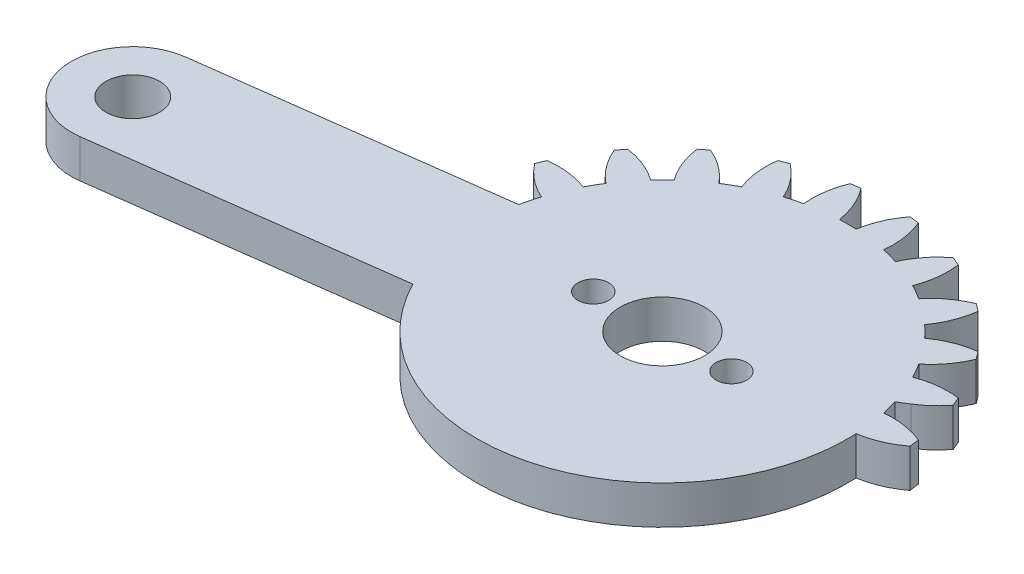
from build123d import *
from build123d.topology import SkipClean

# Parameters (mm, degrees)
SKETCH1_R           = 1.5
BOSS_EXTRUDE1_DEPTH = 2.5
BOSS_EXTRUDE2_START = -2.5
SKETCH3_R           = 1.5
SKETCH3_R_2         = 1.75
BOSS_EXTRUDE2_DEPTH = 2.5
CUT_EXTRUDE1_START  = -4
CUT_EXTRUDE1_DEPTH  = 4
CUT_EXTRUDE2_REACH  = 48.97
SKETCH5_R           = 2.75
SKETCH5_R_2         = 1


with BuildPart() as part:
    # Sketch1 → Boss-Extrude1 (new body)
    with BuildSketch(Plane(origin=(0, 0, 0), x_dir=(1, 0, 0), z_dir=(0, 1, 0))):
        with BuildLine():
            Line((20.643657446, 4), (2.081641936, 4))
            ThreePointArc((2.081641936, 4), (2.861028333, 4.588201733), (3.521749436, 5.30713988))
            ThreePointArc((3.521749436, 5.30713988), (3.405395609, 5.596745198), (3.282888305, 5.883801663))
            ThreePointArc((3.282888305, 5.883801663), (1.93527598, 5.894040025), (0.627094961, 5.57027124))
            ThreePointArc((0.627094961, 5.57027124), (0.366286148, 6.046375), (0.084372603, 6.510293938))
            ThreePointArc((0.084372603, 6.510293938), (1.018855105, 7.48132754), (1.683794586, 8.65351323))
            ThreePointArc((1.683794586, 8.65351323), (1.496450048, 8.903135899), (1.303821399, 9.148703928))
            ThreePointArc((1.303821399, 9.148703928), (-0.000522033, 8.809805691), (-1.180330337, 8.158486898))
            ThreePointArc((-1.180330337, 8.158486898), (-1.555477026, 8.550865528), (-1.947855656, 8.926012217))
            ThreePointArc((-1.947855656, 8.926012217), (-1.296536862, 10.105820521), (-0.957638625, 11.410163953))
            ThreePointArc((-0.957638625, 11.410163953), (-1.203206655, 11.602792602), (-1.452829324, 11.79013714))
            ThreePointArc((-1.452829324, 11.79013714), (-2.625015014, 11.125197659), (-3.596048616, 10.190715157))
            ThreePointArc((-3.596048616, 10.190715157), (-4.059967554, 10.472628702), (-4.536071314, 10.733437515))
            ThreePointArc((-4.536071314, 10.733437515), (-4.212302529, 12.041618533), (-4.222540891, 13.389230859))
            ThreePointArc((-4.222540891, 13.389230859), (-4.509597355, 13.511738163), (-4.799202674, 13.62809199))
            ThreePointArc((-4.799202674, 13.62809199), (-5.759348103, 12.682425791), (-6.455432668, 11.528463019))
            ThreePointArc((-6.455432668, 11.528463019), (-6.976508546, 11.680699536), (-7.503891752, 11.809396783))
            ThreePointArc((-7.503891752, 11.809396783), (-7.529737283, 13.156800143), (-7.888414517, 14.455843809))
            ThreePointArc((-7.888414517, 14.455843809), (-8.197396993, 14.499881098), (-8.507248835, 14.537314892))
            ThreePointArc((-8.507248835, 14.537314892), (-9.18992168, 13.375367565), (-9.563620196, 12.080565177))
            ThreePointArc((-9.563620196, 12.080565177), (-10.106342554, 12.09275), (-10.649064912, 12.080565177))
            ThreePointArc((-10.649064912, 12.080565177), (-11.022763428, 13.375367565), (-11.705436272, 14.537314892))
            ThreePointArc((-11.705436272, 14.537314892), (-12.015288115, 14.499881098), (-12.324270591, 14.455843809))
            ThreePointArc((-12.324270591, 14.455843809), (-12.682947825, 13.156800143), (-12.708793355, 11.809396783))
            ThreePointArc((-12.708793355, 11.809396783), (-13.236176561, 11.680699536), (-13.757252439, 11.528463019))
            ThreePointArc((-13.757252439, 11.528463019), (-14.453337005, 12.682425791), (-15.413482434, 13.62809199))
            ThreePointArc((-15.413482434, 13.62809199), (-15.703087752, 13.511738163), (-15.990144217, 13.389230859))
            ThreePointArc((-15.990144217, 13.389230859), (-16.000382579, 12.041618533), (-15.676613793, 10.733437515))
            ThreePointArc((-15.676613793, 10.733437515), (-16.152717554, 10.472628702), (-16.616636492, 10.190715157))
            ThreePointArc((-16.616636492, 10.190715157), (-17.587670094, 11.125197659), (-18.759855783, 11.79013714))
            ThreePointArc((-18.759855783, 11.79013714), (-19.009478453, 11.602792602), (-19.255046482, 11.410163953))
            ThreePointArc((-19.255046482, 11.410163953), (-18.916148245, 10.105820521), (-18.264829452, 8.926012217))
            ThreePointArc((-18.264829452, 8.926012217), (-18.657208082, 8.550865528), (-19.032354771, 8.158486898))
            ThreePointArc((-19.032354771, 8.158486898), (-20.212163074, 8.809805691), (-21.516506507, 9.148703928))
            ThreePointArc((-21.516506507, 9.148703928), (-21.709135156, 8.903135899), (-21.896479694, 8.65351323))
            ThreePointArc((-21.896479694, 8.65351323), (-21.231540213, 7.48132754), (-20.297057711, 6.510293938))
            ThreePointArc((-20.297057711, 6.510293938), (-20.578971255, 6.046375), (-20.839780068, 5.57027124))
            ThreePointArc((-20.839780068, 5.57027124), (-22.147961087, 5.894040025), (-23.495573413, 5.883801663))
            ThreePointArc((-23.495573413, 5.883801663), (-23.618080717, 5.596745198), (-23.734434544, 5.30713988))
            ThreePointArc((-23.734434544, 5.30713988), (-22.788768345, 4.346994451), (-21.634805572, 3.650909885))
            ThreePointArc((-21.634805572, 3.650909885), (-21.78704209, 3.129834008), (-21.915739337, 2.602450802))
            ThreePointArc((-21.915739337, 2.602450802), (-23.263142697, 2.576605271), (-24.562186363, 2.217928037))
            ThreePointArc((-24.562186363, 2.217928037), (-24.606223651, 1.908945561), (-24.643657446, 1.599093719))
            ThreePointArc((-24.643657446, 1.599093719), (-23.481710119, 0.916420874), (-22.186907731, 0.542722358))
            ThreePointArc((-22.186907731, 0.542722358), (-22.199092554, 0), (-22.186907731, -0.542722358))
            ThreePointArc((-22.186907731, -0.542722358), (-23.481710119, -0.916420874), (-24.643657446, -1.599093719))
            ThreePointArc((-24.643657446, -1.599093719), (-24.606223651, -1.908945561), (-24.562186363, -2.217928037))
            ThreePointArc((-24.562186363, -2.217928037), (-23.263142697, -2.576605271), (-21.915739337, -2.602450802))
            ThreePointArc((-21.915739337, -2.602450802), (-21.78704209, -3.129834008), (-21.634805572, -3.650909885))
            ThreePointArc((-21.634805572, -3.650909885), (-22.788768345, -4.346994451), (-23.734434544, -5.30713988))
            ThreePointArc((-23.734434544, -5.30713988), (-23.618080717, -5.596745198), (-23.495573413, -5.883801663))
            ThreePointArc((-23.495573413, -5.883801663), (-22.147961087, -5.894040025), (-20.839780068, -5.57027124))
            ThreePointArc((-20.839780068, -5.57027124), (-20.578971255, -6.046375), (-20.297057711, -6.510293938))
            ThreePointArc((-20.297057711, -6.510293938), (-21.231540213, -7.48132754), (-21.896479694, -8.65351323))
            ThreePointArc((-21.896479694, -8.65351323), (-21.709135156, -8.903135899), (-21.516506507, -9.148703928))
            ThreePointArc((-21.516506507, -9.148703928), (-20.212163074, -8.809805691), (-19.032354771, -8.158486898))
            ThreePointArc((-19.032354771, -8.158486898), (-18.657208082, -8.550865528), (-18.264829452, -8.926012217))
            ThreePointArc((-18.264829452, -8.926012217), (-18.916148245, -10.105820521), (-19.255046482, -11.410163953))
            ThreePointArc((-19.255046482, -11.410163953), (-19.009478453, -11.602792602), (-18.759855783, -11.79013714))
            ThreePointArc((-18.759855783, -11.79013714), (-17.587670094, -11.125197659), (-16.616636492, -10.190715157))
            ThreePointArc((-16.616636492, -10.190715157), (-16.152717554, -10.472628702), (-15.676613793, -10.733437515))
            ThreePointArc((-15.676613793, -10.733437515), (-16.000382579, -12.041618533), (-15.990144217, -13.389230859))
            ThreePointArc((-15.990144217, -13.389230859), (-15.703087752, -13.511738163), (-15.413482434, -13.62809199))
            ThreePointArc((-15.413482434, -13.62809199), (-14.453337005, -12.682425791), (-13.757252439, -11.528463019))
            ThreePointArc((-13.757252439, -11.528463019), (-13.236176561, -11.680699536), (-12.708793355, -11.809396783))
            ThreePointArc((-12.708793355, -11.809396783), (-12.682947825, -13.156800143), (-12.324270591, -14.455843809))
            ThreePointArc((-12.324270591, -14.455843809), (-12.015288115, -14.499881098), (-11.705436272, -14.537314892))
            ThreePointArc((-11.705436272, -14.537314892), (-11.022763428, -13.375367565), (-10.649064912, -12.080565177))
            ThreePointArc((-10.649064912, -12.080565177), (-10.106342554, -12.09275), (-9.563620196, -12.080565177))
            ThreePointArc((-9.563620196, -12.080565177), (-9.18992168, -13.375367565), (-8.507248835, -14.537314892))
            ThreePointArc((-8.507248835, -14.537314892), (-8.197396993, -14.499881098), (-7.888414517, -14.455843809))
            ThreePointArc((-7.888414517, -14.455843809), (-7.529737283, -13.156800143), (-7.503891752, -11.809396783))
            ThreePointArc((-7.503891752, -11.809396783), (-6.976508546, -11.680699536), (-6.455432668, -11.528463019))
            ThreePointArc((-6.455432668, -11.528463019), (-5.759348103, -12.682425791), (-4.799202674, -13.62809199))
            ThreePointArc((-4.799202674, -13.62809199), (-4.509597355, -13.511738163), (-4.222540891, -13.389230859))
            ThreePointArc((-4.222540891, -13.389230859), (-4.212302529, -12.041618533), (-4.536071314, -10.733437515))
            ThreePointArc((-4.536071314, -10.733437515), (-4.059967554, -10.472628702), (-3.596048616, -10.190715157))
            ThreePointArc((-3.596048616, -10.190715157), (-2.625015014, -11.125197659), (-1.452829324, -11.79013714))
            ThreePointArc((-1.452829324, -11.79013714), (-1.203206655, -11.602792602), (-0.957638625, -11.410163953))
            ThreePointArc((-0.957638625, -11.410163953), (-1.296536862, -10.105820521), (-1.947855656, -8.926012217))
            ThreePointArc((-1.947855656, -8.926012217), (-1.555477026, -8.550865528), (-1.180330337, -8.158486898))
            ThreePointArc((-1.180330337, -8.158486898), (-0.000522033, -8.809805691), (1.303821399, -9.148703928))
            ThreePointArc((1.303821399, -9.148703928), (1.496450048, -8.903135899), (1.683794586, -8.65351323))
            ThreePointArc((1.683794586, -8.65351323), (1.018855105, -7.48132754), (0.084372603, -6.510293938))
            ThreePointArc((0.084372603, -6.510293938), (0.366286148, -6.046375), (0.627094961, -5.57027124))
            ThreePointArc((0.627094961, -5.57027124), (1.93527598, -5.894040025), (3.282888305, -5.883801663))
            ThreePointArc((3.282888305, -5.883801663), (3.405395609, -5.596745198), (3.521749436, -5.30713988))
            ThreePointArc((3.521749436, -5.30713988), (2.861028333, -4.588201733), (2.081641936, -4))
            Line((2.081641936, -4), (20.643657446, -4))
            ThreePointArc((20.643657446, -4), (24.643657446, 0), (20.643657446, 4))
        make_face()
        with Locations((-10.106342554, 0)):
            Circle(SKETCH1_R, mode=Mode.SUBTRACT)
        with Locations((20.643657446, 0)):
            Circle(SKETCH1_R, mode=Mode.SUBTRACT)
    extrude(amount=BOSS_EXTRUDE1_DEPTH)

    # Sketch3 → Boss-Extrude2 (add)
    with BuildSketch(Plane(origin=(0, 2.5, 0), x_dir=(1, 0, 0), z_dir=(0, 1, 0)).offset(BOSS_EXTRUDE2_START)):
        with BuildLine():
            Line((-10.628447323, 3.965779445), (-41.11537681, -0.047900965))
            ThreePointArc((-41.11537681, -0.047900965), (-44.559051487, -4.53578518), (-40.071167272, -7.979459856))
            Line((-40.071167272, -7.979459856), (-9.584237785, -3.965779445))
            ThreePointArc((-9.584237785, -3.965779445), (-6.140563108, 0.522104769), (-10.628447323, 3.965779445))
        make_face()
        with Locations((-10.106342554, 0)):
            Circle(SKETCH3_R, mode=Mode.SUBTRACT)
        with Locations((-40.593272041, -4.013680411)):
            Circle(SKETCH3_R_2, mode=Mode.SUBTRACT)
    extrude(amount=BOSS_EXTRUDE2_DEPTH)

    # Sketch4 → Cut-Extrude1 (cut)
    with SkipClean():  # the faces are left unmerged after this step: merging them gives an invalid solid
        with BuildSketch(Plane(origin=(0, 2.5, 0), x_dir=(1, 0, 0), z_dir=(0, 1, 0)).offset(CUT_EXTRUDE1_START)):
            with BuildLine():
                ThreePointArc((20.643657446, -4), (24.643657446, 0), (20.643657446, 4))
                Line((20.643657446, 4), (2.081641936, 4))
                Line((2.081641936, 4), (1.43808022, 3.600125745))
                ThreePointArc((1.43808022, 3.600125745), (1.581217534, 3.104116905), (1.70305423, 2.602450802))
                ThreePointArc((1.70305423, 2.602450802), (3.050457589, 2.576605271), (4.349501255, 2.217928037))
                ThreePointArc((4.349501255, 2.217928037), (4.393538544, 1.908945561), (4.430972339, 1.599093719))
                ThreePointArc((4.430972339, 1.599093719), (3.269025011, 0.916420874), (1.974222624, 0.542722358))
                ThreePointArc((1.974222624, 0.542722358), (1.70305423, -2.602450802), (0.627094961, -5.57027124))
                ThreePointArc((0.627094961, -5.57027124), (1.93527598, -5.894040025), (3.282888305, -5.883801663))
                ThreePointArc((3.282888305, -5.883801663), (3.405395609, -5.596745198), (3.521749436, -5.30713988))
                ThreePointArc((3.521749436, -5.30713988), (2.861028333, -4.588201733), (2.081641936, -4))
                Line((2.081641936, -4), (20.643657446, -4))
            make_face()
            with BuildLine():
                ThreePointArc((1.683794586, -8.65351323), (1.018855105, -7.48132754), (0.084372603, -6.510293938))
                ThreePointArc((0.084372603, -6.510293938), (-0.512518948, -7.361599771), (-1.180330337, -8.158486898))
                ThreePointArc((-1.180330337, -8.158486898), (-0.000522033, -8.809805691), (1.303821399, -9.148703928))
                ThreePointArc((1.303821399, -9.148703928), (1.496450048, -8.903135899), (1.683794586, -8.65351323))
            make_face()
            with BuildLine():
                ThreePointArc((-0.957638625, -11.410163953), (-1.296536862, -10.105820521), (-1.947855656, -8.926012217))
                ThreePointArc((-1.947855656, -8.926012217), (-2.744742783, -9.593823606), (-3.596048616, -10.190715157))
                ThreePointArc((-3.596048616, -10.190715157), (-2.625015014, -11.125197659), (-1.452829324, -11.79013714))
                ThreePointArc((-1.452829324, -11.79013714), (-1.203206655, -11.602792602), (-0.957638625, -11.410163953))
            make_face()
            with BuildLine():
                ThreePointArc((-4.222540891, -13.389230859), (-4.212302529, -12.041618533), (-4.536071314, -10.733437515))
                ThreePointArc((-4.536071314, -10.733437515), (-5.478647477, -11.172244217), (-6.455432668, -11.528463019))
                ThreePointArc((-6.455432668, -11.528463019), (-5.759348103, -12.682425791), (-4.799202674, -13.62809199))
                ThreePointArc((-4.799202674, -13.62809199), (-4.509597355, -13.511738163), (-4.222540891, -13.389230859))
            make_face()
            with BuildLine():
                ThreePointArc((-7.888414517, -14.455843809), (-7.529737283, -13.156800143), (-7.503891752, -11.809396783))
                ThreePointArc((-7.503891752, -11.809396783), (-8.527921943, -11.989294847), (-9.563620196, -12.080565177))
                ThreePointArc((-9.563620196, -12.080565177), (-9.18992168, -13.375367565), (-8.507248835, -14.537314892))
                ThreePointArc((-8.507248835, -14.537314892), (-8.197396993, -14.499881098), (-7.888414517, -14.455843809))
            make_face()
            with BuildLine():
                ThreePointArc((-11.705436272, -14.537314892), (-11.022763428, -13.375367565), (-10.649064912, -12.080565177))
                ThreePointArc((-10.649064912, -12.080565177), (-11.684763165, -11.989294847), (-12.708793355, -11.809396783))
                ThreePointArc((-12.708793355, -11.809396783), (-12.682947825, -13.156800143), (-12.324270591, -14.455843809))
                ThreePointArc((-12.324270591, -14.455843809), (-12.015288115, -14.499881098), (-11.705436272, -14.537314892))
            make_face()
            with BuildLine():
                ThreePointArc((-15.413482434, -13.62809199), (-14.453337005, -12.682425791), (-13.757252439, -11.528463019))
                ThreePointArc((-13.757252439, -11.528463019), (-14.734037631, -11.172244217), (-15.676613793, -10.733437515))
                ThreePointArc((-15.676613793, -10.733437515), (-16.000382579, -12.041618533), (-15.990144217, -13.389230859))
                ThreePointArc((-15.990144217, -13.389230859), (-15.703087752, -13.511738163), (-15.413482434, -13.62809199))
            make_face()
            with BuildLine():
                ThreePointArc((-18.759855783, -11.79013714), (-17.587670094, -11.125197659), (-16.616636492, -10.190715157))
                ThreePointArc((-16.616636492, -10.190715157), (-17.467942324, -9.593823606), (-18.264829452, -8.926012217))
                ThreePointArc((-18.264829452, -8.926012217), (-18.916148245, -10.105820521), (-19.255046482, -11.410163953))
                ThreePointArc((-19.255046482, -11.410163953), (-19.009478453, -11.602792602), (-18.759855783, -11.79013714))
            make_face()
            with BuildLine():
                ThreePointArc((-21.516506507, -9.148703928), (-20.212163074, -8.809805691), (-19.032354771, -8.158486898))
                ThreePointArc((-19.032354771, -8.158486898), (-19.70016616, -7.361599771), (-20.297057711, -6.510293938))
                ThreePointArc((-20.297057711, -6.510293938), (-21.231540213, -7.48132754), (-21.896479694, -8.65351323))
                ThreePointArc((-21.896479694, -8.65351323), (-21.709135156, -8.903135899), (-21.516506507, -9.148703928))
            make_face()
            with BuildLine():
                ThreePointArc((-21.942853375, 2.47620963), (-21.92946485, 2.539366405), (-21.915739337, 2.602450802))
                ThreePointArc((-21.915739337, 2.602450802), (-23.263142697, 2.576605271), (-24.562186363, 2.217928037))
                ThreePointArc((-24.562186363, 2.217928037), (-24.56889027, 2.173784387), (-24.575459377, 2.129620475))
                Line((-24.575459377, 2.129620475), (-21.942853375, 2.47620963))
            make_face()
            with BuildLine():
                ThreePointArc((-23.495573413, -5.883801663), (-22.147961087, -5.894040025), (-20.839780068, -5.57027124))
                ThreePointArc((-20.839780068, -5.57027124), (-20.869365339, -5.512888815), (-20.898643838, -5.455349261))
                Line((-20.898643838, -5.455349261), (-23.531249839, -5.801938416))
                ThreePointArc((-23.531249839, -5.801938416), (-23.513474108, -5.842897269), (-23.495573413, -5.883801663))
            make_face()
        extrude(amount=CUT_EXTRUDE1_DEPTH, mode=Mode.SUBTRACT)

    # Sketch5 → Cut-Extrude2 (cut, up to next)
    with BuildSketch(Plane(origin=(0, 2.5, 0), x_dir=(1, 0, 0), z_dir=(0, 1, 0)), mode=Mode.PRIVATE) as cut_extrude2_sk1:
        with Locations((-10.106342554, 0)):
            Circle(SKETCH5_R)
    cut_extrude2_tool1 = extrude(cut_extrude2_sk1.sketch, amount=-CUT_EXTRUDE2_REACH, mode=Mode.PRIVATE) & part.part
    # Sketch5 → Cut-Extrude2 (cut, up to next)
    with BuildSketch(Plane(origin=(0, 2.5, 0), x_dir=(1, 0, 0), z_dir=(0, 1, 0)), mode=Mode.PRIVATE) as cut_extrude2_sk2:
        with Locations((-5.606342554, 0)):
            Circle(SKETCH5_R_2)
    cut_extrude2_tool2 = extrude(cut_extrude2_sk2.sketch, amount=-CUT_EXTRUDE2_REACH, mode=Mode.PRIVATE) & part.part
    # Sketch5 → Cut-Extrude2 (cut, up to next)
    with BuildSketch(Plane(origin=(0, 2.5, 0), x_dir=(1, 0, 0), z_dir=(0, 1, 0)), mode=Mode.PRIVATE) as cut_extrude2_sk3:
        with Locations((-14.606342554, 0)):
            Circle(SKETCH5_R_2)
    cut_extrude2_tool3 = extrude(cut_extrude2_sk3.sketch, amount=-CUT_EXTRUDE2_REACH, mode=Mode.PRIVATE) & part.part
    add(cut_extrude2_tool1.solids().sort_by_distance((-10.106343, 2.5, 0))[0], mode=Mode.SUBTRACT)
    add(cut_extrude2_tool2.solids().sort_by_distance((-5.606343, 2.5, 0))[0], mode=Mode.SUBTRACT)
    add(cut_extrude2_tool3.solids().sort_by_distance((-14.606343, 2.5, 0))[0], mode=Mode.SUBTRACT)


solid = part.part
